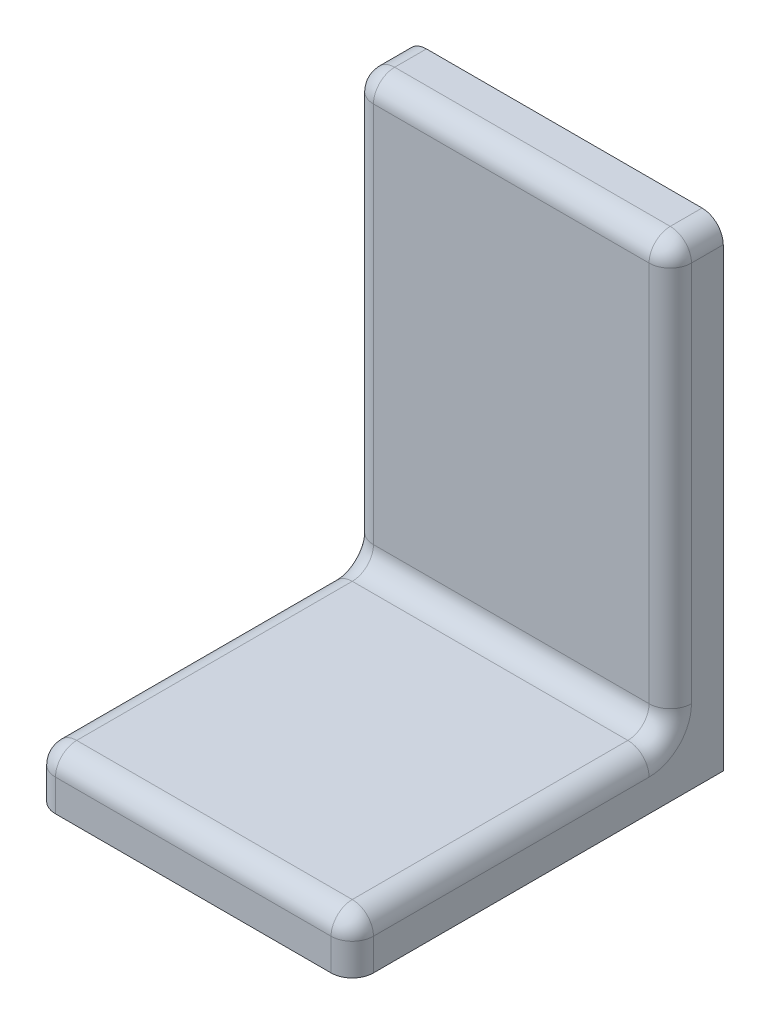
from build123d import *

# Parameters (mm, degrees)
SKETCH1_W           = 600
SKETCH1_H           = 600
BOSS_EXTRUDE1_DEPTH = 100
SKETCH2_W           = 600
SKETCH2_H           = 900
BOSS_EXTRUDE2_DEPTH = 100
FILLET1_R           = 40


with BuildPart() as part:
    # Sketch1 → Boss-Extrude1 (new body)
    with BuildSketch(Plane(origin=(0, 0, 0), x_dir=(1, 0, 0), z_dir=(0, 1, 0))):
        Rectangle(SKETCH1_W, SKETCH1_H)
    extrude(amount=BOSS_EXTRUDE1_DEPTH)

    # Sketch2 → Boss-Extrude2 (add)
    with BuildSketch(Plane(origin=(0, 0, -300), x_dir=(-1, 0, 0), z_dir=(0, 0, -1))):
        with Locations((0, 450)):
            Rectangle(SKETCH2_W, SKETCH2_H)
    extrude(amount=BOSS_EXTRUDE2_DEPTH)

    # Fillet1
    fillet1_edges = [part.edges().sort_by_distance(p)[0] for p in [
        (-300, 900, -350),
        (300, 900, -350),
        (-300, 50, 300),
        (-300, 100, 0),
        (0, 100, 300),
        (300, 50, 300),
        (300, 100, 0),
        (300, 500, -300),
        (0, 900, -300),
        (-300, 500, -300),
        (0, 100, -300),
    ]]
    fillet(fillet1_edges, radius=FILLET1_R)


solid = part.part
